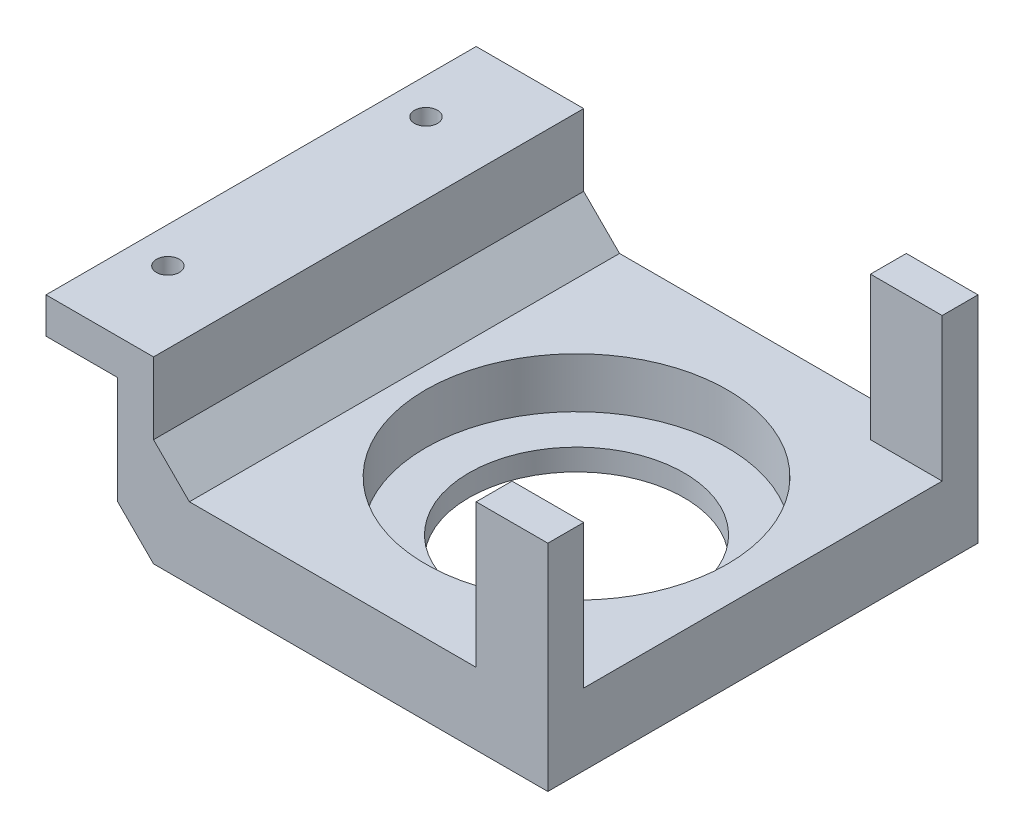
from build123d import *

# Parameters (mm, degrees)
SALIENTE_EXTRUIR2_DEPTH    = 60
CROQUIS6_R                 = 21.05
CORTAR_EXTRUIR1_DEPTH      = 7
CORTAR_EXTRUIR2_DEPTH      = 77.159874807
CORTAR_EXTRUIR2_DEPTH_BACK = 77.159874807
CROQUIS8_R                 = 15
CORTAR_EXTRUIR3_DEPTH      = 76.606392128
CORTAR_EXTRUIR3_DEPTH_BACK = 76.606392128
CROQUIS9_R                 = 1.6
CHAFL_N1_SIZE              = 5
CROQUIS11_W                = 10
CROQUIS11_H                = 5
SALIENTE_EXTRUIR3_DEPTH    = 20


with BuildPart() as part:
    # Croquis4 → Saliente-Extruir2 (new body)
    with BuildSketch(Plane.XY):
        Polygon((-31.428571429, 5.761904762), (-31.428571429, 14.761904762), (-41.428571429, 14.761904762), (-41.428571429, 19.761904762), (-26.428571429, 19.761904762), (-26.428571429, 4.761904762), (28.571428571, 4.761904762), (28.571428571, -5.238095238), (-31.428571429, -5.238095238), align=None)
    extrude(amount=SALIENTE_EXTRUIR2_DEPTH)

    # Croquis6 → Cortar-Extruir1 (cut)
    with BuildSketch(Plane(origin=(0, 4.761904762, 0), x_dir=(1, 0, 0), z_dir=(0, 1, 0))):
        with Locations((2.571428571, -30)):
            Circle(CROQUIS6_R)
    extrude(amount=-CORTAR_EXTRUIR1_DEPTH, mode=Mode.SUBTRACT)

    # Croquis8 → Cortar-Extruir2 (cut, two sides: drawn at the far end of the back side and taken through both)
    with BuildSketch(Plane(origin=(0, -2.238095238, 0), x_dir=(1, 0, 0), z_dir=(0, 1, 0)).offset(-CORTAR_EXTRUIR2_DEPTH_BACK)):
        with Locations((2.571428571, -30)):
            Circle(CROQUIS8_R)
    extrude(amount=CORTAR_EXTRUIR2_DEPTH + CORTAR_EXTRUIR2_DEPTH_BACK, mode=Mode.SUBTRACT)

    # Croquis9 → Cortar-Extruir3 (cut, two sides: drawn at the far end of the back side and taken through both)
    with BuildSketch(Plane.XZ.offset(-14.761904762).offset(-CORTAR_EXTRUIR3_DEPTH_BACK)):
        with Locations((-36.428571429, 48)):
            Circle(CROQUIS9_R)
        with Locations((-36.428571429, 12)):
            Circle(CROQUIS9_R)
    extrude(amount=CORTAR_EXTRUIR3_DEPTH + CORTAR_EXTRUIR3_DEPTH_BACK, mode=Mode.SUBTRACT)

    # Chaflán1
    chafl_n1_edges = [part.edges().sort_by_distance(p)[0] for p in [
        (-26.428571429, 4.761904762, 30),
        (-31.428571429, -5.238095238, 30),
    ]]
    chamfer(chafl_n1_edges, length=CHAFL_N1_SIZE)

    # Croquis11 → Saliente-Extruir3 (add)
    with BuildSketch(Plane(origin=(0, 4.761904762, 0), x_dir=(1, 0, 0), z_dir=(0, 1, 0))):
        with Locations((23.571428571, -2.5)):
            Rectangle(CROQUIS11_W, CROQUIS11_H)
        with Locations((23.571428571, -57.5)):
            Rectangle(CROQUIS11_W, CROQUIS11_H)
    extrude(amount=SALIENTE_EXTRUIR3_DEPTH)


solid = part.part
